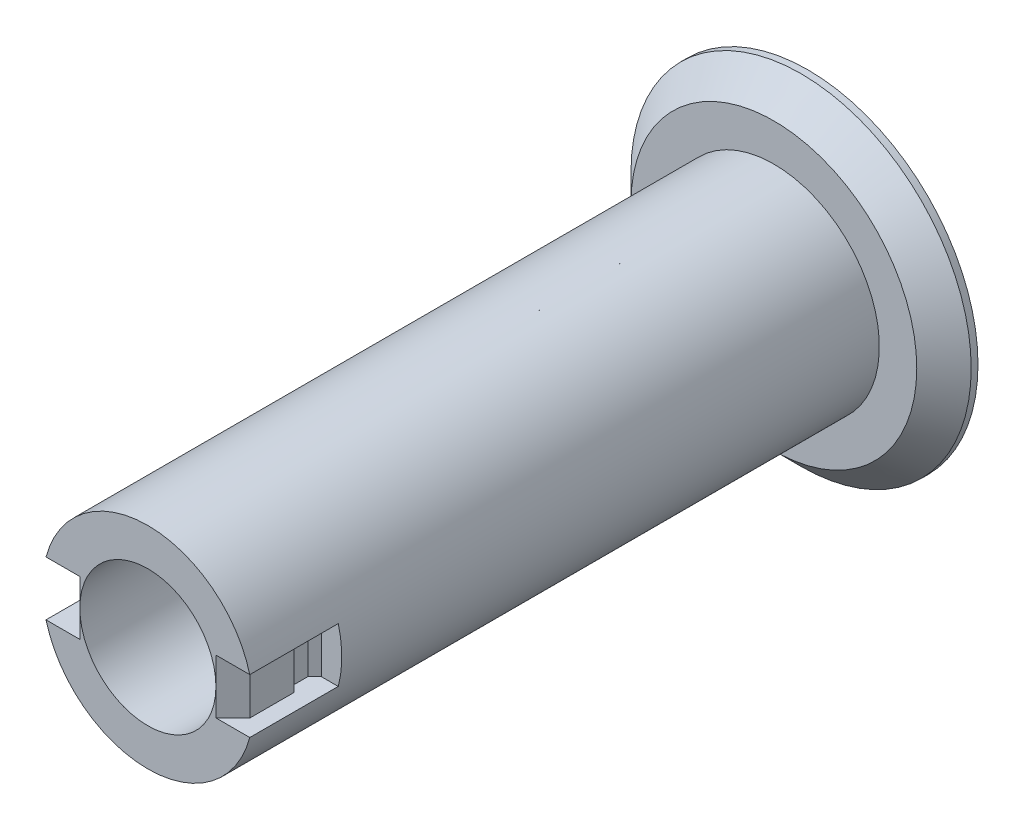
from build123d import *

# Parameters (mm, degrees)
AXLE_BASE_SKETCH_R          = 15.5
AXLE_DEPTH                  = 92
GUARD_BASE_R                = 25
GUARD_DEPTH                 = 5
INNER_AXLE_HOLE_BASE_R      = 10
INNER_AXLE_HOLE_DEPTH       = 104.242433137
COUPLING_TOOTH_HOLE_DEPTH   = 4
UNCOUPLING_FINGER_ROOM_SIZE = 4


with BuildPart() as part:
    # Axle base sketch → Axle (new body)
    with BuildSketch(Plane.XY):
        Circle(AXLE_BASE_SKETCH_R)
    extrude(amount=AXLE_DEPTH)

    # Guard base → Guard (add)
    with BuildSketch(Plane(origin=(0, 0, 0), x_dir=(-1, 0, 0), z_dir=(0, 0, -1))):
        Circle(GUARD_BASE_R)
    extrude(amount=GUARD_DEPTH)

    # Inner axle hole base → Inner axle hole (cut, through all)
    with BuildSketch(Plane.XY.offset(92)):
        Circle(INNER_AXLE_HOLE_BASE_R)
    extrude(amount=-INNER_AXLE_HOLE_DEPTH, mode=Mode.SUBTRACT)

    # Coupling tooth base → Coupling tooth hole (cut, symmetric)
    with BuildSketch(Plane(origin=(0, 0, 0), x_dir=(1, 0, 0), z_dir=(0, 1, 0))):
        Polygon((12.5, -89.5), (10, -92), (15.5, -92), (15.5, -79), (12.5, -79), (11.5, -80), (11.5, -82), (12.5, -83), align=None)
    coupling_tooth_hole = extrude(amount=COUPLING_TOOTH_HOLE_DEPTH, both=True, mode=Mode.SUBTRACT)

    # Coupling teeth: Coupling tooth hole across plane
    add(coupling_tooth_hole.mirror(Plane(origin=(0, 0, 0), x_dir=(0, 0, 1), z_dir=(1, 0, 0))), mode=Mode.SUBTRACT)

    # Uncoupling finger room
    uncoupling_finger_room_edges = [part.edges().sort_by_distance(p)[0] for p in [
        (25, 0, 0),
    ]]
    chamfer(uncoupling_finger_room_edges, length=UNCOUPLING_FINGER_ROOM_SIZE)


solid = part.part
